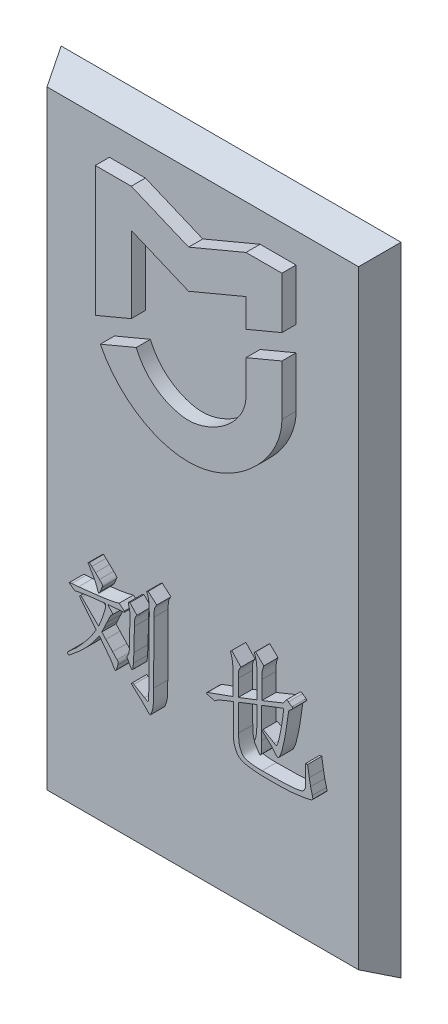
from build123d import *

# Parameters (mm, degrees)
EXTRUDE_2_DEPTH     = 1
EXTRUDE_3_DEPTH     = 1
SKETCH_5_R          = 0.4
CUT_EXTRUDE_1_DEPTH = 1


with BuildPart() as part:
    # 草图1 → 放样1 section 0
    with BuildSketch(Plane.XY):
        with BuildLine():
            Line((-12, -22.5), (12, -22.5))
            Line((12, -22.5), (12, 22.5))
            Line((12, 22.5), (-12, 22.5))
            Line((-12, 22.5), (-12, -22.5))
        make_face()
    # 草图2 → 放样1 section 1
    with BuildSketch(Plane.XY.offset(2)):
        with BuildLine():
            Line((-11, -21.5), (11, -21.5))
            Line((11, -21.5), (11, 21.5))
            Line((11, 21.5), (-11, 21.5))
            Line((-11, 21.5), (-11, -21.5))
        make_face()
    loft()

    # 草图3 → 凸台-拉伸2 (add)
    with BuildSketch(Plane.XY.offset(2)):
        Polygon((-6.59, 10.23382716), (-6.59, 19.4), (-4.05, 19.4), (0, 17.7), (4.05, 19.4), (6.59, 19.4), (6.59, 15.76617284), (4.05, 14.7), (4.05, 16.7), (0, 15), (-4.05, 16.7), (-4.05, 11.3), align=None)
        with BuildLine():
            Line((4.05, 12.964761344), (6.59, 14.030934184))
            Line((6.59, 14.030934184), (6.59, 10.459517091))
            add(Edge.make_bspline(
                [(-6.235218606, 8.64750909), (-4.870751444, 5.947394248), (1.072971475, 2.342935771), (6.59, 7.938736003), (6.59, 10.459517091)],
                knots=[0, 0, 0, 0, 0.499282993, 1, 1, 1, 1], degree=3))
            Line((-6.235218606, 8.64750909), (-3.695218606, 9.713681929))
            add(Edge.make_bspline(
                [(-3.695218606, 9.713681929), (-2.940743033, 7.888143936), (-0.801318312, 7.003787028), (2.044547534, 7.264383406), (4.05, 9.040341702), (4.05, 10.590681389)],
                knots=[0, 0, 0, 0, 0.291621451, 0.391621451, 1, 1, 1, 1], degree=3))
            Line((4.05, 10.590681389), (4.05, 12.964761344))
        make_face()
    extrude(amount=EXTRUDE_2_DEPTH)

    # 草图4 → 凸台-拉伸3 (add)
    with BuildSketch(Plane.XY.offset(2)):
        with BuildLine():
            Line((-8.572640102, -11.356275304), (-8.489431068, -11.276582144))
            add(Edge.make_bspline(
                [(-8.489431068, -11.276582144), (-8.487102642, -11.274222113), (-8.479919452, -11.26694142), (-8.464455773, -11.253109954), (-8.440995037, -11.231599565), (-8.408212918, -11.20432458), (-8.368397552, -11.168685503), (-8.320578485, -11.12615507), (-8.262484228, -11.079018955), (-8.198293109, -11.02198794), (-8.125328607, -10.957913374), (-8.045523556, -10.884158006), (-7.960432272, -10.79963996), (-7.868954307, -10.705549125), (-7.770603386, -10.60232134), (-7.664771878, -10.490097642), (-7.554007435, -10.366887423), (-7.395584982, -10.188599855), (-7.195095267, -9.949743526), (-6.962266965, -9.641910281), (-6.73418016, -9.313780869), (-6.591033759, -9.083715457), (-6.518197315, -8.966652461)],
                knots=[0, 0, 0, 0, 0.065198425, 0.201137099, 0.40788454, 0.691245695, 1.039649119, 1.458886768, 1.949802964, 2.510713657, 3.147535011, 3.859802736, 4.647635779, 5.506150487, 6.440913925, 7.452015177, 8.540013055, 9.699438529, 12.143195968, 14.671182652, 17.288565393, 20, 20, 20, 20], degree=3))
            add(Edge.make_bspline(
                [(-6.518197315, -8.966652461), (-6.551386378, -8.925230272), (-6.615857065, -8.844766504), (-6.710164448, -8.727617542), (-6.797153343, -8.616028151), (-6.881184525, -8.512770287), (-6.959269669, -8.415852749), (-7.032032006, -8.32569305), (-7.098727635, -8.242082833), (-7.161189856, -8.165796084), (-7.218356808, -8.095977451), (-7.269426343, -8.032674649), (-7.316271936, -7.977034696), (-7.356280691, -7.927307442), (-7.391570472, -7.884493774), (-7.422603651, -7.849759215), (-7.446647673, -7.82002438), (-7.482325048, -7.780974613), (-7.524037139, -7.733527834), (-7.568263128, -7.680624955), (-7.599421129, -7.643873885), (-7.611804451, -7.622141244), (-7.616322182, -7.614212657)],
                knots=[0, 0, 0, 0, 1.827584404, 3.550134084, 5.17818748, 6.699085863, 8.133857546, 9.463588509, 10.68828112, 11.81638999, 12.858375418, 13.79531207, 14.61680579, 15.362570389, 15.992897519, 16.526881144, 16.966046865, 17.308977679, 18.34783297, 19.140064244, 19.686274889, 20, 20, 20, 20], degree=3))
            Line((-7.616322182, -7.614212657), (-7.710078841, -7.495844875))
            Line((-7.710078841, -7.495844875), (-7.616322182, -7.400916258))
            Line((-7.616322182, -7.400916258), (-7.533113147, -7.47943746))
            add(Edge.make_bspline(
                [(-7.533113147, -7.47943746), (-7.518277841, -7.494682203), (-7.48205751, -7.531902171), (-7.417988499, -7.597139761), (-7.334018608, -7.681558238), (-7.197503262, -7.824702129), (-7.003687411, -8.016899055), (-6.808045965, -8.217746949), (-6.651379681, -8.374396183), (-6.542307787, -8.481739327), (-6.445152089, -8.578762173), (-6.382353512, -8.638610263), (-6.352951204, -8.666631153)],
                knots=[0, 0, 0, 0, 0.381202874, 0.930705058, 1.638610867, 2.514934367, 4.475265986, 6.529681396, 7.53953632, 8.445449116, 9.272158899, 10, 10, 10, 10], degree=3))
            add(Edge.make_bspline(
                [(-6.352951204, -8.666631153), (-6.315350704, -8.579327445), (-6.243342817, -8.41213404), (-6.147704256, -8.168963739), (-6.064214979, -7.946888845), (-5.994465519, -7.746294719), (-5.942007913, -7.56984082), (-5.900016452, -7.422130231), (-5.87642653, -7.302797499), (-5.871163207, -7.232604999), (-5.868932453, -7.202855316)],
                knots=[0, 0, 0, 0, 1.474595011, 2.823964356, 4.053229764, 5.155257442, 6.117713211, 6.908648701, 7.537452643, 8, 8, 8, 8], degree=3))
            Line((-5.868932453, -7.202855316), (-5.868932453, -7.028233539))
            Line((-5.868932453, -7.028233539), (-6.872128702, -7.139569572))
            Line((-6.872128702, -7.139569572), (-7.344427871, -7.202855316))
            Line((-7.344427871, -7.202855316), (-7.840166205, -7.289580226))
            Line((-7.840166205, -7.289580226), (-8.040571063, -7.329426806))
            Line((-8.040571063, -7.329426806), (-8.112060516, -7.274344769))
            Line((-8.112060516, -7.274344769), (-8.359343703, -7.099722992))
            add(Edge.make_bspline(
                [(-8.359343703, -7.099722992), (-8.374723862, -7.090384301), (-8.39909875, -7.075584093), (-8.430601311, -7.053937432), (-8.42965414, -7.02295263), (-8.381289584, -7.011876886), (-8.324059584, -6.998794537), (-8.269601365, -6.992654323), (-8.24214788, -6.989558918)],
                knots=[0, 0, 0, 0, 1.121234416, 1.776962435, 2.134305725, 2.718973422, 4.345968391, 6, 6, 6, 6], degree=3))
            Line((-8.24214788, -6.989558918), (-7.769848711, -6.957916045))
            add(Edge.make_bspline(
                [(-7.769848711, -6.957916045), (-7.669440202, -6.947074782), (-7.464677343, -6.924966217), (-7.151862182, -6.889318655), (-6.827131725, -6.853464977), (-6.606863778, -6.827932119), (-6.49475815, -6.81493714)],
                knots=[0, 0, 0, 0, 0.94452247, 1.926162656, 2.94451807, 4, 4, 4, 4], degree=3))
            add(Edge.make_bspline(
                [(-6.49475815, -6.81493714), (-6.404857185, -6.804795675), (-6.231505038, -6.785240326), (-5.982054385, -6.750467463), (-5.752189708, -6.717055795), (-5.542669264, -6.68230385), (-5.353710851, -6.645527779), (-5.184485251, -6.610182044), (-5.035992695, -6.571799881), (-4.944553591, -6.543363909), (-4.902066908, -6.530151289)],
                knots=[0, 0, 0, 0, 1.340028019, 2.583918127, 3.730414233, 4.780639395, 5.729374167, 6.581716138, 7.341002119, 8, 8, 8, 8], degree=3))
            Line((-4.902066908, -6.530151289), (-4.536415939, -6.823140848))
            add(Edge.make_bspline(
                [(-4.536415939, -6.823140848), (-4.529913064, -6.833325246), (-4.517515032, -6.852742273), (-4.522021238, -6.886349832), (-4.54042477, -6.91384752), (-4.561061593, -6.916644559), (-4.571574686, -6.918069465)],
                knots=[0, 0, 0, 0, 1.108907477, 2.114183501, 3.039301546, 4, 4, 4, 4], degree=3))
            Line((-4.571574686, -6.918069465), (-5.125910931, -6.957916045))
            Line((-5.125910931, -6.957916045), (-5.716577882, -7.012998082))
            Line((-5.716577882, -7.012998082), (-5.338035372, -7.424355423))
            add(Edge.make_bspline(
                [(-5.338035372, -7.424355423), (-5.377116109, -7.457951432), (-5.450065205, -7.520662595), (-5.513508979, -7.609496341), (-5.546037599, -7.673891822), (-5.566860906, -7.715247319), (-5.591148249, -7.765993382), (-5.621312062, -7.824757088), (-5.653623325, -7.893767916), (-5.689571092, -7.972256525), (-5.73098203, -8.05919057), (-5.759944539, -8.120106217), (-5.775175794, -8.152141487)],
                knots=[0, 0, 0, 0, 1.798071595, 3.356326024, 3.771905468, 4.321877619, 4.975761954, 5.739612164, 6.631977536, 7.640722647, 8.759266462, 10, 10, 10, 10], degree=3))
            Line((-5.775175794, -8.152141487), (-5.999019817, -8.626784573))
            Line((-5.999019817, -8.626784573), (-6.129107181, -8.903366716))
            Line((-6.129107181, -8.903366716), (-5.845493288, -9.211591732))
            Line((-5.845493288, -9.211591732), (-5.361474537, -9.726081398))
            Line((-5.361474537, -9.726081398), (-5.055593437, -10.058917537))
            add(Edge.make_bspline(
                [(-5.055593437, -10.058917537), (-5.043524262, -10.074543573), (-5.021723584, -10.102769045), (-4.992348597, -10.140113533), (-4.976184974, -10.171433985), (-4.964695379, -10.196386324), (-4.966615424, -10.223668902), (-4.971298768, -10.256783887), (-4.980971409, -10.300771819), (-4.990503869, -10.332839438), (-4.995823567, -10.350735137)],
                knots=[0, 0, 0, 0, 1.471541512, 2.658060923, 3.516730293, 4.105519251, 4.658005317, 5.509257306, 6.610012704, 8, 8, 8, 8], degree=3))
            Line((-4.995823567, -10.350735137), (-5.102471766, -10.691774984))
            add(Edge.make_bspline(
                [(-5.102471766, -10.691774984), (-5.107147123, -10.704078385), (-5.115449333, -10.725926004), (-5.131593865, -10.752603673), (-5.149561225, -10.770151049), (-5.170838576, -10.775497396), (-5.192667761, -10.770018093), (-5.212991699, -10.752183029), (-5.235221737, -10.72628862), (-5.248546028, -10.704154554), (-5.255998295, -10.691774984)],
                knots=[0, 0, 0, 0, 1.338862206, 2.377468899, 3.168046985, 3.824919533, 4.520498723, 5.372871164, 6.530648424, 8, 8, 8, 8], degree=3))
            Line((-5.255998295, -10.691774984), (-5.349754954, -10.525356915))
            Line((-5.349754954, -10.525356915), (-5.491561901, -10.280417643))
            add(Edge.make_bspline(
                [(-5.491561901, -10.280417643), (-5.498276384, -10.271878453), (-5.514845262, -10.250806869), (-5.541929361, -10.211537756), (-5.582306788, -10.162736188), (-5.628695652, -10.099347843), (-5.687362774, -10.025984931), (-5.752152839, -9.938408724), (-5.828670639, -9.840522378), (-5.911213039, -9.734656395), (-5.992060232, -9.628172022), (-6.067208019, -9.531611677), (-6.131115483, -9.446985385), (-6.182762647, -9.374030633), (-6.227084888, -9.316274869), (-6.258549482, -9.269532162), (-6.28140686, -9.237092094), (-6.290948487, -9.218298117), (-6.294353292, -9.211591732)],
                knots=[0, 0, 0, 0, 0.389863755, 0.962040541, 1.71102706, 2.661763996, 3.780925674, 5.08221877, 6.571569266, 8.240473453, 9.9008138, 11.370495022, 12.63251324, 13.706762763, 14.578975611, 15.244117614, 15.730273277, 16, 16, 16, 16], degree=3))
            add(Edge.make_bspline(
                [(-6.294353292, -9.211591732), (-6.328029907, -9.258803034), (-6.393115364, -9.350046441), (-6.486115565, -9.483191964), (-6.576178164, -9.604860115), (-6.658493963, -9.718415737), (-6.736472523, -9.82216483), (-6.808582054, -9.916137765), (-6.874340348, -10.001435231), (-6.958615688, -10.104962377), (-7.072186762, -10.236301247), (-7.229177982, -10.401082493), (-7.411898334, -10.58415022), (-7.615611673, -10.775466123), (-7.821702385, -10.962408676), (-8.014248045, -11.131456849), (-8.18686249, -11.273069515), (-8.297000416, -11.356569885), (-8.347624121, -11.394949925)],
                knots=[0, 0, 0, 0, 0.924161645, 1.786090527, 2.587992116, 3.336343607, 4.021144613, 4.656172426, 5.224022083, 5.73738697, 6.783357507, 7.990038028, 9.363483117, 10.904835513, 12.442978656, 13.797571463, 14.987677581, 16, 16, 16, 16], degree=3))
            Line((-8.347624121, -11.394949925), (-8.477711485, -11.489878543))
            Line((-8.477711485, -11.489878543), (-8.572640102, -11.356275304))
        make_face()
        with BuildLine():
            Line((-7.108864266, -5.16130407), (-7.002216066, -5.090986576))
            Line((-7.002216066, -5.090986576), (-6.836969955, -5.249200938))
            Line((-6.836969955, -5.249200938), (-6.577967185, -5.494140209))
            Line((-6.577967185, -5.494140209), (-6.294353292, -5.770722352))
            add(Edge.make_bspline(
                [(-6.294353292, -5.770722352), (-6.27602565, -5.789504901), (-6.241685162, -5.824697747), (-6.19314885, -5.873479791), (-6.15332074, -5.917251181), (-6.120536727, -5.954072996), (-6.095952051, -5.984950472), (-6.077770221, -6.008053188), (-6.067036815, -6.025691133), (-6.061748982, -6.052165925), (-6.083045905, -6.095798389), (-6.096998888, -6.134558489), (-6.105668016, -6.158640528)],
                knots=[0, 0, 0, 0, 1.63346026, 3.06061321, 4.282431432, 5.3163233, 6.128971342, 6.736848627, 7.150205181, 7.398171432, 8.38345782, 10, 10, 10, 10], degree=3))
            Line((-6.105668016, -6.158640528), (-6.224035798, -6.44342638))
            add(Edge.make_bspline(
                [(-6.224035798, -6.44342638), (-6.234319848, -6.465410194), (-6.252605877, -6.504499525), (-6.280351739, -6.555319324), (-6.306607312, -6.589746641), (-6.331590108, -6.611517452), (-6.359538343, -6.613641578), (-6.382596791, -6.595940715), (-6.399262421, -6.563602296), (-6.407743021, -6.537354725), (-6.412721074, -6.521947582)],
                knots=[0, 0, 0, 0, 1.747463608, 3.107158041, 4.147542065, 4.872930297, 5.407725713, 6.015799549, 6.835288031, 8, 8, 8, 8], degree=3))
            Line((-6.412721074, -6.521947582), (-6.436160239, -6.44342638))
            add(Edge.make_bspline(
                [(-6.436160239, -6.44342638), (-6.454257315, -6.389662649), (-6.490296655, -6.282595115), (-6.555888574, -6.126694021), (-6.626832783, -5.973875071), (-6.680199969, -5.875160087), (-6.706882591, -5.82580439)],
                knots=[0, 0, 0, 0, 1.007605425, 2.006591188, 3.003331848, 4, 4, 4, 4], degree=3))
            Line((-6.706882591, -5.82580439), (-6.872128702, -5.549222246))
            add(Edge.make_bspline(
                [(-6.872128702, -5.549222246), (-6.892963334, -5.515302079), (-6.929196602, -5.456311908), (-6.973806735, -5.380469779), (-7.00152768, -5.330362494), (-7.010945325, -5.304341535), (-7.013935649, -5.296079267)],
                knots=[0, 0, 0, 0, 1.643511411, 2.858211656, 3.637455284, 4, 4, 4, 4], degree=3))
            Line((-7.013935649, -5.296079267), (-7.108864266, -5.16130407))
        make_face()
        with BuildLine():
            Line((-4.264521628, -6.166844236), (-4.146153846, -6.118793948))
            Line((-4.146153846, -6.118793948), (-3.650415512, -6.641487322))
            add(Edge.make_bspline(
                [(-3.650415512, -6.641487322), (-3.668405074, -6.666617938), (-3.701302329, -6.712573937), (-3.740237921, -6.778294956), (-3.770520182, -6.830824564), (-3.791314273, -6.889527508), (-3.804219031, -6.963785339), (-3.815314303, -7.043994403), (-3.820999217, -7.123889096), (-3.824356277, -7.203215314), (-3.826562942, -7.299726401), (-3.827094686, -7.370053603), (-3.827381206, -7.407948008)],
                knots=[0, 0, 0, 0, 1.148689223, 2.100591564, 2.841616315, 3.397752752, 4.406508581, 5.637440437, 6.40971506, 7.384193564, 8.590525089, 10, 10, 10, 10], degree=3))
            Line((-3.827381206, -7.407948008), (-3.863711911, -9.038141913))
            Line((-3.863711911, -9.038141913), (-3.898870658, -9.702642233))
            add(Edge.make_bspline(
                [(-3.898870658, -9.702642233), (-3.900701489, -9.733120164), (-3.904154682, -9.79060565), (-3.910832879, -9.87115403), (-3.919604086, -9.940980376), (-3.926919276, -10.000198001), (-3.93638332, -10.048228363), (-3.945593092, -10.085641378), (-3.955033867, -10.112588359), (-3.969155226, -10.134096238), (-3.999057126, -10.14191415), (-4.032084223, -10.116269811), (-4.064715088, -10.072012717), (-4.086458806, -10.033543003), (-4.099275517, -10.010867249)],
                knots=[0, 0, 0, 0, 1.741345291, 3.284411967, 4.608104704, 5.754997356, 6.685671286, 7.39895411, 7.949210064, 8.314616316, 8.822660524, 9.491408112, 10.521324798, 12, 12, 12, 12], degree=3))
            Line((-4.099275517, -10.010867249), (-4.205923716, -9.821010015))
            Line((-4.205923716, -9.821010015), (-4.299680375, -9.654591945))
            add(Edge.make_bspline(
                [(-4.299680375, -9.654591945), (-4.312257457, -9.632150329), (-4.33303836, -9.595070419), (-4.349340385, -9.54524387), (-4.343163034, -9.509184288), (-4.330490786, -9.478707358), (-4.31285519, -9.439939174), (-4.275803996, -9.378946654), (-4.231733647, -9.286850932), (-4.202636205, -9.155026625), (-4.183734885, -9.004737243), (-4.182152787, -8.89719345), (-4.181312593, -8.840080972)],
                knots=[0, 0, 0, 0, 0.908775013, 1.50155387, 1.779225433, 2.174543822, 2.659777538, 3.274567743, 4.681337539, 6.223134886, 7.994248462, 10, 10, 10, 10], degree=3))
            Line((-4.181312593, -8.840080972), (-4.146153846, -7.163008736))
            Line((-4.146153846, -7.163008736), (-4.134434264, -6.823140848))
            add(Edge.make_bspline(
                [(-4.134434264, -6.823140848), (-4.139038659, -6.78601945), (-4.149668114, -6.700323014), (-4.165644508, -6.586081772), (-4.185216731, -6.477191427), (-4.20445436, -6.381480032), (-4.23218239, -6.276981655), (-4.253410376, -6.204685716), (-4.264521628, -6.166844236)],
                knots=[0, 0, 0, 0, 1.004718895, 2.319439319, 3.097450702, 3.976140336, 4.940661892, 6, 6, 6, 6], degree=3))
        make_face()
        with BuildLine():
            Line((-2.860515662, -4.781589602), (-2.246409546, -5.312486682))
            add(Edge.make_bspline(
                [(-2.246409546, -5.312486682), (-2.264035219, -5.340190287), (-2.296153165, -5.390672494), (-2.338630012, -5.458846884), (-2.368194337, -5.512905685), (-2.388812806, -5.556050925), (-2.401633015, -5.598714638), (-2.411755282, -5.649335866), (-2.420468638, -5.712434762), (-2.433964887, -5.81645641), (-2.444173462, -5.966645736), (-2.445895329, -6.091824344), (-2.446814404, -6.158640528)],
                knots=[0, 0, 0, 0, 1.107829367, 2.018714633, 2.708701103, 3.186432451, 3.628276706, 4.207258238, 4.92669759, 5.776724593, 7.745755843, 10, 10, 10, 10], degree=3))
            Line((-2.446814404, -6.158640528), (-2.470253569, -10.508949499))
            add(Edge.make_bspline(
                [(-2.470253569, -10.508949499), (-2.470191063, -10.534342175), (-2.470051619, -10.590989815), (-2.471371054, -10.685142495), (-2.474064421, -10.79724553), (-2.476705045, -10.971500971), (-2.483061745, -11.204759008), (-2.490416142, -11.442315436), (-2.501555136, -11.633222657), (-2.524877222, -11.771312109), (-2.555878701, -11.904877266), (-2.597218292, -12.026983401), (-2.638318023, -12.131197693), (-2.674133495, -12.205210497), (-2.693039374, -12.256055903), (-2.712925402, -12.269894129), (-2.718708715, -12.273918602)],
                knots=[0, 0, 0, 0, 0.589887852, 1.315960387, 2.187368415, 3.194878865, 5.364534501, 7.607595883, 8.717778585, 9.802445062, 10.856809642, 11.898561704, 12.798471782, 13.44440659, 13.838420698, 14, 14, 14, 14], degree=3))
            add(Edge.make_bspline(
                [(-2.718708715, -12.273918602), (-2.725480278, -12.271013586), (-2.746381721, -12.262046817), (-2.781362819, -12.230959956), (-2.832526959, -12.182786243), (-2.872622334, -12.144657428), (-2.895674409, -12.12273599)],
                knots=[0, 0, 0, 0, 0.376746688, 1.162885112, 2.368854668, 4, 4, 4, 4], degree=3))
            Line((-2.895674409, -12.12273599), (-3.31992329, -11.687939484))
            Line((-3.31992329, -11.687939484), (-3.922309823, -11.141806947))
            Line((-3.922309823, -11.141806947), (-4.052397187, -11.008203708))
            Line((-4.052397187, -11.008203708), (-3.95746857, -10.913275091))
            Line((-3.95746857, -10.913275091), (-3.863711911, -10.976560835))
            Line((-3.863711911, -10.976560835), (-3.107798849, -11.411357341))
            add(Edge.make_bspline(
                [(-3.107798849, -11.411357341), (-3.078256466, -11.428486819), (-3.026886631, -11.45827245), (-2.959355942, -11.497124969), (-2.915818116, -11.515172253), (-2.886116638, -11.530528488), (-2.869294428, -11.516468914), (-2.858672666, -11.496197318), (-2.845400549, -11.46572215), (-2.839350628, -11.440792786), (-2.835904539, -11.426592798)],
                knots=[0, 0, 0, 0, 2.251948108, 3.915804794, 5.017275759, 5.521087774, 5.83410483, 6.317942711, 7.041885137, 8, 8, 8, 8], degree=3))
            add(Edge.make_bspline(
                [(-2.835904539, -11.426592798), (-2.832973765, -11.410222346), (-2.826035815, -11.371468964), (-2.831267608, -11.3011203), (-2.832285579, -11.208561316), (-2.827259527, -11.126027328), (-2.819807292, -11.058688264), (-2.818708834, -11.011282533), (-2.813891738, -10.953968329), (-2.812940168, -10.887064208), (-2.808141675, -10.810187708), (-2.807043381, -10.723780934), (-2.802472933, -10.627738296), (-2.801339006, -10.560521446), (-2.800745792, -10.525356915)],
                knots=[0, 0, 0, 0, 0.661094864, 1.564994195, 2.796083087, 4.357100893, 4.857916312, 5.497544336, 6.246947197, 7.151249365, 8.165167655, 9.318668215, 10.597259789, 12, 12, 12, 12], degree=3))
            Line((-2.800745792, -10.525356915), (-2.777306627, -6.000426167))
            add(Edge.make_bspline(
                [(-2.777306627, -6.000426167), (-2.777357473, -5.976191658), (-2.777460083, -5.927285386), (-2.783007944, -5.863730747), (-2.785468913, -5.805076762), (-2.789847437, -5.74773122), (-2.791170799, -5.676942128), (-2.796187553, -5.56713361), (-2.803701078, -5.427801777), (-2.817837563, -5.288865294), (-2.842120323, -5.176017187), (-2.871393383, -5.078289598), (-2.915217465, -4.966514864), (-2.948247964, -4.887384219), (-2.965991903, -4.844875346)],
                knots=[0, 0, 0, 0, 0.737943854, 1.489202202, 1.942057474, 2.526287226, 3.240730149, 4.098329235, 5.874776145, 7.49262476, 8.344590405, 9.387589738, 10.596616841, 12, 12, 12, 12], degree=3))
            Line((-2.965991903, -4.844875346), (-2.860515662, -4.781589602))
        make_face()
        with BuildLine():
            Line((3.141785638, -8.215427232), (3.141785638, -6.759855103))
            add(Edge.make_bspline(
                [(3.141785638, -6.759855103), (3.140448372, -6.665669889), (3.137714369, -6.473110932), (3.118237307, -6.229493641), (3.091868981, -6.02721976), (3.058541911, -5.868621713), (3.012979425, -5.705255722), (2.973377805, -5.59663581), (2.953100362, -5.541018538)],
                knots=[0, 0, 0, 0, 1.366080099, 2.792911388, 3.542214245, 4.323489746, 5.141566903, 6, 6, 6, 6], degree=3))
            Line((2.953100362, -5.541018538), (3.046857021, -5.446089921))
            Line((3.046857021, -5.446089921), (3.696121884, -6.142233113))
            add(Edge.make_bspline(
                [(3.696121884, -6.142233113), (3.679923487, -6.164764365), (3.649871746, -6.206565004), (3.610688262, -6.266513333), (3.58084434, -6.319174903), (3.559516589, -6.367442465), (3.544514193, -6.416194576), (3.534851373, -6.470988213), (3.52526943, -6.533451396), (3.516198232, -6.629199917), (3.51001579, -6.758211975), (3.508312816, -6.863762129), (3.507436608, -6.918069465)],
                knots=[0, 0, 0, 0, 1.016750241, 1.88630489, 2.623201631, 3.232209614, 3.816314471, 4.487277711, 5.26871086, 6.131879465, 8.009786694, 10, 10, 10, 10], degree=3))
            Line((3.507436608, -6.918069465), (3.507436608, -8.088855743))
            Line((3.507436608, -8.088855743), (4.829405498, -7.574366077))
            Line((4.829405498, -7.574366077), (4.829405498, -6.190283401))
            add(Edge.make_bspline(
                [(4.829405498, -6.190283401), (4.828906915, -6.133641132), (4.827954449, -6.025434614), (4.828281311, -5.871070473), (4.822316442, -5.732827261), (4.817340166, -5.573231826), (4.803673626, -5.394785201), (4.777410567, -5.22605326), (4.748572886, -5.095869813), (4.720352583, -4.992519301), (4.683860492, -4.881631337), (4.655448746, -4.805710944), (4.640720222, -4.766354144)],
                knots=[0, 0, 0, 0, 1.174615812, 2.243926496, 3.200347047, 4.043432971, 5.555037318, 6.908129539, 7.580284618, 8.319173575, 9.12866694, 10, 10, 10, 10], degree=3))
            Line((4.640720222, -4.766354144), (4.73447688, -4.686660984))
            Line((4.73447688, -4.686660984), (5.313424249, -5.256232687))
            add(Edge.make_bspline(
                [(5.313424249, -5.256232687), (5.300065788, -5.289271127), (5.274522755, -5.352444721), (5.245170873, -5.445877579), (5.218031405, -5.530776892), (5.199119573, -5.615816807), (5.185837269, -5.712552658), (5.177017729, -5.833854568), (5.173414156, -5.985950787), (5.172251413, -6.097698217), (5.171617302, -6.158640528)],
                knots=[0, 0, 0, 0, 0.927559545, 1.773608857, 2.549207339, 3.247651318, 4.038902691, 5.089847824, 6.41292637, 8, 8, 8, 8], degree=3))
            Line((5.171617302, -6.158640528), (5.171617302, -7.447794588))
            Line((5.171617302, -7.447794588), (6.693991051, -6.831344556))
            Line((6.693991051, -6.831344556), (6.882676326, -6.561794162))
            add(Edge.make_bspline(
                [(6.882676326, -6.561794162), (6.889738018, -6.552978017), (6.904517596, -6.534526505), (6.947536802, -6.53428854), (6.995336514, -6.551815563), (7.028759365, -6.573055409), (7.047922438, -6.585233326)],
                knots=[0, 0, 0, 0, 0.695967854, 1.456607212, 2.541739575, 4, 4, 4, 4], degree=3))
            Line((7.047922438, -6.585233326), (7.295205625, -6.759855103))
            add(Edge.make_bspline(
                [(7.295205625, -6.759855103), (7.311422336, -6.773012578), (7.3389851, -6.795375706), (7.354208915, -6.841200014), (7.338465217, -6.875026349), (7.312527613, -6.904018328), (7.273986064, -6.941168714), (7.224661475, -6.981579438), (7.174213398, -7.022691035), (7.13111233, -7.060301011), (7.100272244, -7.091696105), (7.076940139, -7.116034723), (7.066898252, -7.146709401), (7.056259942, -7.187151584), (7.045662466, -7.248152642), (7.031072236, -7.328822297), (7.016640435, -7.429437684), (6.998718422, -7.549697558), (6.978701508, -7.689884129), (6.951990602, -7.89789938), (6.918060418, -8.154405164), (6.875061226, -8.440976468), (6.836895898, -8.692611907), (6.795464656, -8.911389564), (6.75740587, -9.105127633), (6.720750095, -9.280385769), (6.687430459, -9.441658539), (6.653132574, -9.588502149), (6.619520593, -9.7232408), (6.58325458, -9.846951651), (6.543663525, -9.960918632), (6.500952877, -10.062874494), (6.459920963, -10.150514857), (6.426519424, -10.221779022), (6.399453519, -10.27542477), (6.374616703, -10.319263032), (6.341541289, -10.35720818), (6.307600561, -10.358394083), (6.292009376, -10.358938845)],
                knots=[0, 0, 0, 0, 0.576698045, 0.980186008, 1.214405268, 1.577809683, 2.062254003, 2.702675296, 3.351442089, 3.875172274, 4.290357963, 4.584139869, 4.794139257, 5.176566183, 5.752340936, 6.513864101, 7.459596091, 8.580606942, 9.89843797, 11.400890293, 14.418006616, 17.099826835, 19.466649527, 21.501216887, 23.296736924, 24.962207149, 26.484865294, 27.880133405, 29.159174751, 30.349596218, 31.467227024, 32.515251607, 33.42504683, 34.159461348, 34.708969399, 35.089381499, 35.581693637, 36, 36, 36, 36], degree=3))
            add(Edge.make_bspline(
                [(6.292009376, -10.358938845), (6.28361878, -10.357494423), (6.26422759, -10.354156275), (6.235746117, -10.334195503), (6.206084263, -10.302934998), (6.185946068, -10.277867624), (6.174813552, -10.264010228)],
                knots=[0, 0, 0, 0, 0.653598932, 1.510507792, 2.623793724, 4, 4, 4, 4], degree=3))
            Line((6.174813552, -10.264010228), (5.856040912, -9.892499467))
            Line((5.856040912, -9.892499467), (5.502109525, -9.552631579))
            Line((5.502109525, -9.552631579), (5.195056467, -9.283081185))
            Line((5.195056467, -9.283081185), (5.265373961, -9.164713403))
            Line((5.265373961, -9.164713403), (6.05644577, -9.615917324))
            add(Edge.make_bspline(
                [(6.05644577, -9.615917324), (6.072228442, -9.626460989), (6.100517492, -9.64535958), (6.140329841, -9.665134005), (6.168304303, -9.680309334), (6.192179477, -9.685155905), (6.213271135, -9.67324216), (6.229906488, -9.647473126), (6.252906346, -9.611380469), (6.278150549, -9.55743508), (6.308930235, -9.480596839), (6.339637604, -9.372543566), (6.377619067, -9.232435117), (6.432457556, -9.004206179), (6.497265602, -8.703198221), (6.549457631, -8.403165898), (6.581179798, -8.178992383), (6.604211627, -8.033452912), (6.622385433, -7.907906074), (6.640574974, -7.793988619), (6.658467737, -7.673367347), (6.677115367, -7.528053572), (6.696436104, -7.349011117), (6.710053139, -7.218485811), (6.717430215, -7.147773279)],
                knots=[0, 0, 0, 0, 0.453246463, 0.812404417, 1.058878365, 1.218682658, 1.364812083, 1.603926935, 1.943372672, 2.390130709, 3.022906896, 3.920704708, 5.071139561, 6.493136379, 9.529059106, 12.42836802, 13.768479543, 14.939637854, 15.949681965, 16.800014907, 17.696501178, 18.863745864, 20.300923596, 22, 22, 22, 22], degree=3))
            Line((6.717430215, -7.147773279), (5.15989772, -7.740784147))
            Line((5.15989772, -7.740784147), (5.15989772, -9.892499467))
            add(Edge.make_bspline(
                [(5.15989772, -9.892499467), (5.160169173, -9.94992802), (5.160680715, -10.058149738), (5.157320563, -10.21087565), (5.156214907, -10.344144456), (5.150759581, -10.45818068), (5.146513438, -10.552756396), (5.141478167, -10.628341549), (5.133392925, -10.684254252), (5.123703674, -10.730976539), (5.10833182, -10.769329342), (5.091622148, -10.801102388), (5.07413461, -10.82356809), (5.059416225, -10.824843748), (5.053249521, -10.825378223)],
                knots=[0, 0, 0, 0, 2.143691412, 4.039697273, 5.702407659, 7.118154537, 8.300811667, 9.236963389, 9.944348472, 10.407801389, 11.017151722, 11.467573231, 11.776923993, 12, 12, 12, 12], degree=3))
            add(Edge.make_bspline(
                [(5.053249521, -10.825378223), (5.041806838, -10.822318343), (5.013217401, -10.814673259), (4.977890354, -10.771305223), (4.932326934, -10.713656451), (4.904082541, -10.663865991), (4.888003409, -10.635520989)],
                knots=[0, 0, 0, 0, 0.54035645, 1.350075697, 2.491435728, 4, 4, 4, 4], degree=3))
            Line((4.888003409, -10.635520989), (4.73447688, -10.37534626))
            add(Edge.make_bspline(
                [(4.73447688, -10.37534626), (4.718935932, -10.351710958), (4.69176029, -10.310381144), (4.660152986, -10.254470629), (4.639204852, -10.216210634), (4.632552111, -10.186224955), (4.641920973, -10.162367364), (4.653641343, -10.134070406), (4.670834643, -10.096982918), (4.695963938, -10.052557029), (4.720918489, -9.995392555), (4.742163714, -9.924529832), (4.760940644, -9.839873609), (4.775605173, -9.7465263), (4.789140116, -9.653526945), (4.799825666, -9.571091847), (4.806662864, -9.503445778), (4.812804883, -9.442577669), (4.814373333, -9.370972243), (4.817156051, -9.27294732), (4.817881942, -9.139709527), (4.817756308, -9.039312497), (4.817685915, -8.983059876)],
                knots=[0, 0, 0, 0, 1.173808522, 2.052577354, 2.661786056, 2.989662642, 3.276948054, 3.698471851, 4.271439325, 4.967631613, 5.817046609, 6.852868893, 8.032819251, 9.413450336, 10.773075076, 11.933370386, 12.862585867, 13.595022828, 14.471095585, 15.833327655, 17.665406662, 20, 20, 20, 20], degree=3))
            Line((4.817685915, -8.983059876), (4.817685915, -7.867355636))
            Line((4.817685915, -7.867355636), (3.51915619, -8.373641594))
            Line((3.51915619, -8.373641594), (3.530875772, -10.25580652))
            add(Edge.make_bspline(
                [(3.530875772, -10.25580652), (3.532582385, -10.343714735), (3.536152228, -10.527598522), (3.551355101, -10.761632982), (3.582797704, -10.958626202), (3.630826347, -11.110989239), (3.701325065, -11.264075372), (3.769472028, -11.396788392), (3.856504893, -11.496896633), (3.958531739, -11.558651128), (4.088958879, -11.612119323), (4.25099357, -11.653141861), (4.442620849, -11.688975381), (4.666153668, -11.709850341), (4.920187836, -11.726026989), (5.100093554, -11.727178331), (5.195056467, -11.727786064)],
                knots=[0, 0, 0, 0, 1.37475614, 2.875673983, 3.662924259, 4.487846686, 5.362891654, 6.298510731, 6.808800076, 7.413601198, 8.141846173, 9.008602374, 10.020904651, 11.1878089, 12.515589925, 14, 14, 14, 14], degree=3))
            add(Edge.make_bspline(
                [(5.195056467, -11.727786064), (5.361476854, -11.728299893), (5.689646713, -11.72931313), (6.17371979, -11.721965405), (6.6426021, -11.708450072), (7.019938742, -11.68979541), (7.304016688, -11.671945214), (7.491242526, -11.654592881), (7.654388645, -11.634171662), (7.793132881, -11.609501529), (7.908678969, -11.583615186), (8.000453018, -11.553960782), (8.069699266, -11.5218226), (8.126772786, -11.472089624), (8.169776948, -11.406181641), (8.21192119, -11.332996483), (8.24104076, -11.261298511), (8.248109689, -11.213123025), (8.251523546, -11.189857234)],
                knots=[0, 0, 0, 0, 2.435412553, 4.802470484, 7.084557297, 9.299674364, 10.331006159, 11.249726022, 12.05101461, 12.736212089, 13.311694378, 13.781735971, 14.147351467, 14.418950814, 14.877518522, 15.289534363, 15.656888879, 16, 16, 16, 16], degree=3))
            Line((8.251523546, -11.189857234), (8.263243128, -9.749520563))
            Line((8.263243128, -9.749520563), (8.405050075, -9.734285105))
            Line((8.405050075, -9.734285105), (8.523417856, -10.485510335))
            Line((8.523417856, -10.485510335), (8.617174515, -10.991796292))
            Line((8.617174515, -10.991796292), (8.735542297, -11.466439378))
            add(Edge.make_bspline(
                [(8.735542297, -11.466439378), (8.737019646, -11.482545544), (8.740501593, -11.520505997), (8.757810382, -11.575816867), (8.775612329, -11.624684036), (8.780674638, -11.654289433), (8.782420626, -11.66450032)],
                knots=[0, 0, 0, 0, 0.948890166, 2.236429188, 3.391745345, 4, 4, 4, 4], degree=3))
            add(Edge.make_bspline(
                [(8.782420626, -11.66450032), (8.778530195, -11.675567521), (8.769890466, -11.700145159), (8.734495718, -11.729396562), (8.68695782, -11.758048163), (8.621604745, -11.784379536), (8.541082945, -11.811095761), (8.44348607, -11.836383492), (8.329693144, -11.860835834), (8.157742699, -11.890979962), (7.936761651, -11.925448642), (7.674695542, -11.958436963), (7.423343117, -11.989005229), (7.216452346, -12.006868885), (7.046419552, -12.017912443), (6.903811366, -12.024836413), (6.745194092, -12.030669531), (6.570154499, -12.034812265), (6.37915441, -12.040406611), (6.172075061, -12.041587816), (5.948634379, -12.044953191), (5.794319369, -12.044467071), (5.714233965, -12.044214788)],
                knots=[0, 0, 0, 0, 0.220872338, 0.49050522, 0.849479933, 1.288241742, 1.831945133, 2.473828796, 3.215740668, 4.05887123, 5.813918467, 7.494968666, 9.113007733, 10.658806846, 11.467843648, 12.373477927, 13.390818632, 14.505053931, 15.72391032, 17.047139882, 18.467543814, 20, 20, 20, 20], degree=3))
            add(Edge.make_bspline(
                [(5.714233965, -12.044214788), (5.634541326, -12.044432381), (5.479444091, -12.044855858), (5.252796949, -12.041861682), (5.038352474, -12.032859907), (4.835868945, -12.023241459), (4.645498469, -12.008193893), (4.467474961, -11.98756551), (4.30110738, -11.966409585), (4.14745805, -11.939301737), (4.006193852, -11.908536125), (3.878266726, -11.870224005), (3.763586022, -11.82458382), (3.662306355, -11.771840409), (3.573746391, -11.713113013), (3.497011175, -11.648754913), (3.435594399, -11.575244443), (3.374029238, -11.47173343), (3.316958272, -11.343425467), (3.257673724, -11.199826941), (3.217392795, -11.068340189), (3.192262396, -10.944595496), (3.180639926, -10.817727068), (3.170784964, -10.677471731), (3.167105868, -10.517167509), (3.165877175, -10.403862457), (3.165224803, -10.343703388)],
                knots=[0, 0, 0, 0, 1.563697605, 3.043256893, 4.447011465, 5.774881593, 7.020633238, 8.193005579, 9.291161952, 10.310660285, 11.253477959, 12.126434436, 12.927803706, 13.67180057, 14.362730949, 15.009565331, 15.62982985, 16.231925079, 17.366916044, 18.381793398, 19.278980222, 20.060678712, 20.854682299, 21.776546203, 22.819462068, 24, 24, 24, 24], degree=3))
            Line((3.165224803, -10.343703388), (3.153505221, -8.51544854))
            add(Edge.make_bspline(
                [(3.153505221, -8.51544854), (3.091778665, -8.539268609), (2.974892747, -8.584374488), (2.808992752, -8.648563799), (2.66305479, -8.70778729), (2.535317176, -8.757600509), (2.427466731, -8.80090484), (2.339281869, -8.837484815), (2.270303863, -8.866292294), (2.202736261, -8.896803867), (2.127632344, -8.934219462), (2.039210208, -8.989422893), (1.942548408, -9.05237116), (1.877409874, -9.099930255), (1.843255913, -9.124866823)],
                knots=[0, 0, 0, 0, 1.641861564, 3.109042709, 4.414155712, 5.550066901, 6.51135182, 7.298071423, 7.919253021, 8.366130611, 9.137834986, 9.999032262, 10.950836482, 12, 12, 12, 12], degree=3))
            Line((1.843255913, -9.124866823), (1.347517579, -8.998295333))
            add(Edge.make_bspline(
                [(1.347517579, -8.998295333), (1.335168865, -8.995799447), (1.313676325, -8.991455436), (1.287484408, -8.977816602), (1.268446721, -8.961695166), (1.264029943, -8.939251103), (1.268800864, -8.916276033), (1.287537343, -8.896955796), (1.312821618, -8.876904897), (1.335019742, -8.868341463), (1.347517579, -8.863520136)],
                knots=[0, 0, 0, 0, 1.321167078, 2.299448864, 3.116480445, 3.837165855, 4.598079319, 5.50687589, 6.596338172, 8, 8, 8, 8], degree=3))
            Line((1.347517579, -8.863520136), (3.141785638, -8.215427232))
        make_face()
    extrude(amount=EXTRUDE_3_DEPTH)

    # 草图5 → 切除-拉伸1 (cut)
    with BuildSketch(Plane(origin=(0, 0, 0), x_dir=(-1, 0, 0), z_dir=(0, 0, -1))):
        with Locations((-8, 14.5)):
            Circle(SKETCH_5_R)
        with Locations((8, 14.5)):
            Circle(SKETCH_5_R)
        with Locations((-8, -14.5)):
            Circle(SKETCH_5_R)
        with Locations((8, -14.5)):
            Circle(SKETCH_5_R)
    extrude(amount=-CUT_EXTRUDE_1_DEPTH, mode=Mode.SUBTRACT)


solid = part.part
